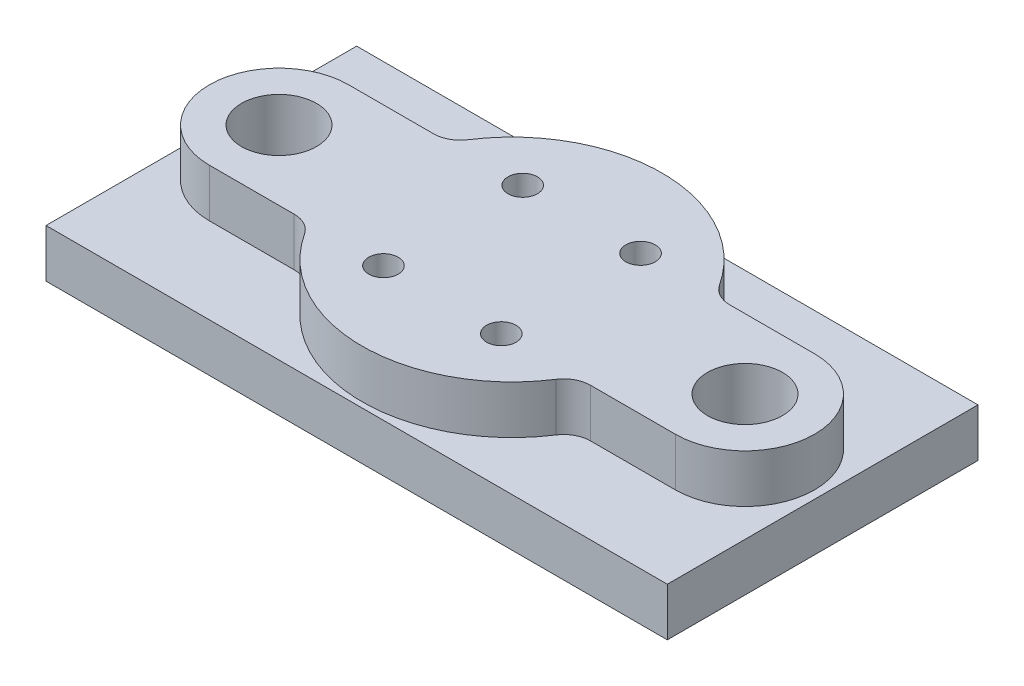
from build123d import *

# Parameters (mm, degrees)
RESSALTO_EXTRUS_O1_DEPTH     = 58
ESBO_O3_R                    = 2.75
RESSALTO_EXTRUS_O2_DEPTH     = 9
FILETE1_R                    = 5
FURO_DE_DI_METRO_0_15_14_1_D = 14
FUROAVAN_ADO1_OUTLINE_R      = 4.75
FUROAVAN_ADO1_DEPTH          = 9


# Read off the part's stored shape, not the designer's step: FuroAvançado1
with BuildPart() as part:
    # Esboço2 → Ressalto-extrusão1 (new body)
    with BuildSketch(Plane.XY):
        Polygon((-58, 0), (0, 0), (58, 0), (58, 9), (0, 9), (-58, 9), align=None)
    extrude(amount=-RESSALTO_EXTRUS_O1_DEPTH)

    # Esboço3 → Ressalto-extrusão2 (add)
    with BuildSketch(Plane(origin=(0, 9, 0), x_dir=(1, 0, 0), z_dir=(0, 1, 0))):
        with BuildLine():
            Line((-43.5, 42), (-24.799193535, 42))
            ThreePointArc((-24.799193535, 42), (0, 57), (24.799193535, 42))
            Line((24.799193535, 42), (43.5, 42))
            ThreePointArc((43.5, 42), (56.5, 29), (43.5, 16))
            Line((43.5, 16), (24.799193535, 16))
            ThreePointArc((24.799193535, 16), (0, 1), (-24.799193535, 16))
            Line((-24.799193535, 16), (-43.5, 16))
            ThreePointArc((-43.5, 16), (-56.5, 29), (-43.5, 42))
        make_face()
        with Locations(Location((-11, 42, 0), (0, 0, 270))):
            Circle(ESBO_O3_R, mode=Mode.SUBTRACT)
        with Locations(Location((11, 42, 0), (0, 0, 270))):
            Circle(ESBO_O3_R, mode=Mode.SUBTRACT)
        with Locations(Location((-11, 16, 0), (0, 0, 270))):
            Circle(ESBO_O3_R, mode=Mode.SUBTRACT)
        with Locations(Location((11, 16, 0), (0, 0, 270))):
            Circle(ESBO_O3_R, mode=Mode.SUBTRACT)
    extrude(amount=RESSALTO_EXTRUS_O2_DEPTH)

    # Filete1
    filete1_edges = [part.edges().sort_by_distance(p)[0] for p in [
        (24.799193535, 13.5, -42),
        (-24.799193535, 13.5, -42),
        (-24.799193535, 13.5, -16),
        (24.799193535, 13.5, -16),
    ]]
    fillet(filete1_edges, radius=FILETE1_R)

    # Furo de diâmetro Ø0.15 (14)1 (through all)
    with Locations(Plane(origin=(0, 18, 0), x_dir=(1, 0, 0), z_dir=(0, 1, 0))):
        with Locations((-43.5, 29), (43.5, 29)):
            Hole(FURO_DE_DI_METRO_0_15_14_1_D / 2)

    # FuroAvançado1 outline → FuroAvançado1 (cut)
    with BuildSketch(Plane(origin=(0, 0, 0), x_dir=(1, 0, 0), z_dir=(0, 1, 0))):
        with Locations((-11, 42)):
            Circle(FUROAVAN_ADO1_OUTLINE_R)
        with Locations((-11, 16)):
            Circle(FUROAVAN_ADO1_OUTLINE_R)
        with Locations((11, 16)):
            Circle(FUROAVAN_ADO1_OUTLINE_R)
        with Locations((11, 42)):
            Circle(FUROAVAN_ADO1_OUTLINE_R)
    extrude(amount=FUROAVAN_ADO1_DEPTH, mode=Mode.SUBTRACT)


solid = part.part
